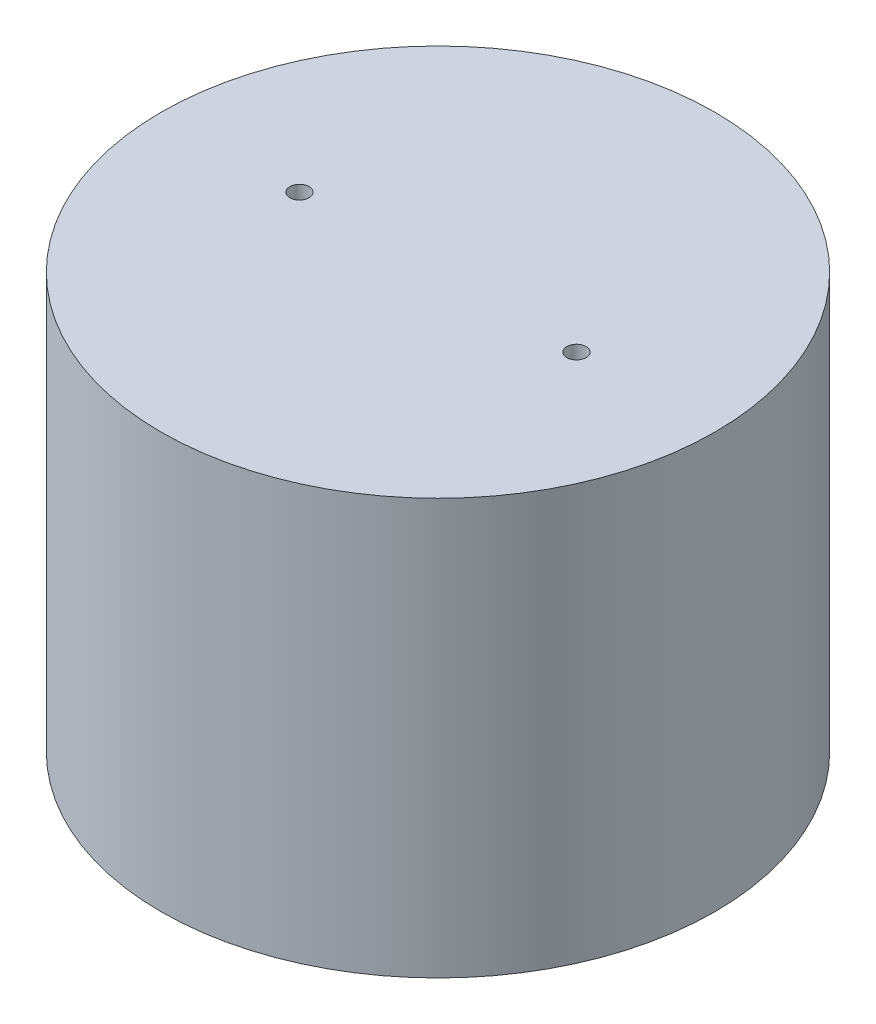
from build123d import *

# Parameters (mm, degrees)
BOSS_EXTRUDE1_DEPTH               = 62.023012247
F_1_4_20_TAPPED_HOLE1_D           = 5.1054
F_1_4_20_TAPPED_HOLE1_DEPTH       = 16.51
F_1_4_20_TAPPED_HOLE1_CSINK_D     = 6.3754
F_1_4_20_TAPPED_HOLE1_CSINK_ANGLE = 90
F_1_4_20_TAPPED_HOLE1_TIP         = 1.533816902
SKETCH11_W                        = 14.690046345
SKETCH11_H                        = 2.54
BOSS_EXTRUDE3_DEPTH               = 65.156264766
SKETCH10_R                        = 9.703139682
BOSS_EXTRUDE4_DEPTH               = 64.578834592
SKETCH13_R                        = 0.884999144
CUT_EXTRUDE2_DEPTH                = 46.345656428
SKETCH15_OUTSIDE_W                = 85.352
SKETCH15_OUTSIDE_H                = 70.996
SKETCH15_OUTSIDE_R                = 25.4
CUT_EXTRUDE3_DEPTH                = 43.434
SKETCH16_R                        = 2.75
CUT_EXTRUDE5_DEPTH                = 8.89


with BuildPart() as part:
    # Sketch2 → Boss-Extrude1 (new body)
    with BuildSketch(Plane(origin=(0, 0, 0), x_dir=(0, 0, -1), z_dir=(1, 0, 0))):
        with BuildLine():
            Line((0, 0), (50.8, 0))
            Line((50.8, 0), (50.8, 17.78))
            Line((50.8, 17.78), (36.109953655, 17.78))
            ThreePointArc((36.109953655, 17.78), (17.145, 19.05), (36.109953655, 20.32))
            Line((36.109953655, 20.32), (50.8, 20.32))
            Line((50.8, 20.32), (50.8, 38.1))
            Line((50.8, 38.1), (0, 38.1))
            Line((0, 38.1), (0, 0))
        make_face()
    extrude(amount=BOSS_EXTRUDE1_DEPTH)

    # 1/4-20 Tapped Hole1
    with Locations(Plane(origin=(0, 0, 0), x_dir=(-1, 0, 0), z_dir=(0, -1, 0))):
        with Locations((-31.011506124, 12.7), (-31.011506124, 38.1)):
            CounterSinkHole(F_1_4_20_TAPPED_HOLE1_D / 2, F_1_4_20_TAPPED_HOLE1_CSINK_D / 2, depth=F_1_4_20_TAPPED_HOLE1_DEPTH, counter_sink_angle=F_1_4_20_TAPPED_HOLE1_CSINK_ANGLE)
            with Locations((0, 0, -(F_1_4_20_TAPPED_HOLE1_DEPTH + F_1_4_20_TAPPED_HOLE1_TIP / 2))):  # 118° drill point
                Cone(0, F_1_4_20_TAPPED_HOLE1_D / 2, F_1_4_20_TAPPED_HOLE1_TIP, mode=Mode.SUBTRACT)

    # Sketch11 → Boss-Extrude3 (add)
    with BuildSketch(Plane.ZY):
        with Locations((-43.454976828, 19.05)):
            Rectangle(SKETCH11_W, SKETCH11_H)
    extrude(amount=-BOSS_EXTRUDE3_DEPTH)

    # Sketch10 → Boss-Extrude4 (add)
    with BuildSketch(Plane(origin=(0, -2.659795234, 0), x_dir=(0, 0, 1), z_dir=(-1, 0, 0))):
        with Locations((-26.802286556, 21.590488848)):
            Circle(SKETCH10_R)
    extrude(amount=-BOSS_EXTRUDE4_DEPTH)

    # Sketch13 → Cut-Extrude2 (cut)
    with BuildSketch(Plane(origin=(0, 38.1, 0), x_dir=(1, 0, 0), z_dir=(0, 1, 0))):
        with Locations((18.311506124, 25.4)):
            Circle(SKETCH13_R)
        with Locations((43.711506124, 25.4)):
            Circle(SKETCH13_R)
    extrude(amount=-CUT_EXTRUDE2_DEPTH, mode=Mode.SUBTRACT)

    # Sketch15 outside → Cut-Extrude3 (cut)
    with BuildSketch(Plane(origin=(0, 38.1, 0), x_dir=(1, 0, 0), z_dir=(0, 1, 0))):
        with Locations((32.578, 25.4)):
            Rectangle(SKETCH15_OUTSIDE_W, SKETCH15_OUTSIDE_H)
        with Locations((31.011506124, 25.4)):
            Circle(SKETCH15_OUTSIDE_R, mode=Mode.SUBTRACT)
    extrude(amount=-CUT_EXTRUDE3_DEPTH, mode=Mode.SUBTRACT)

    # Sketch16 → Cut-Extrude5 (cut)
    with BuildSketch(Plane(origin=(0, 0, 0), x_dir=(-1, 0, 0), z_dir=(0, -1, 0))):
        with Locations((-43.711506124, 25.4)):
            Circle(SKETCH16_R)
        with Locations((-18.311506124, 25.4)):
            Circle(SKETCH16_R)
    extrude(amount=-CUT_EXTRUDE5_DEPTH, mode=Mode.SUBTRACT)


solid = part.part
